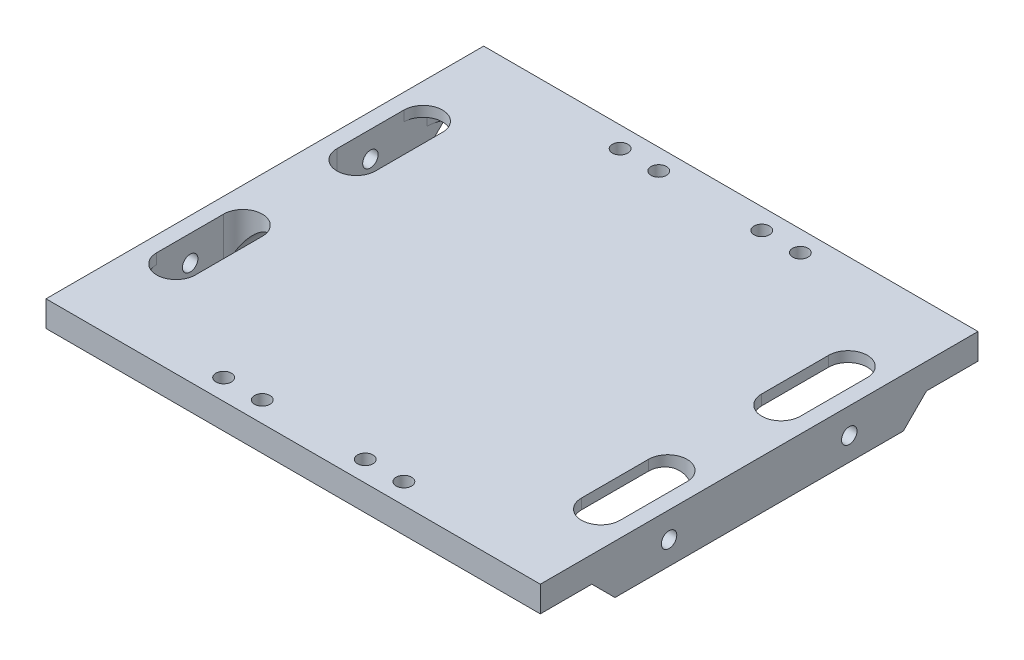
from build123d import *

# Parameters (mm, degrees)
BOSS_EXTRUDE1_DEPTH = 85
SKETCH3_R           = 1.5
CUT_EXTRUDE2_DEPTH  = 129.44162098
CUT_EXTRUDE3_DEPTH  = 99.07777526
SKETCH5_W           = 90
SKETCH5_H           = 8
BOSS_EXTRUDE2_DEPTH = 3
SKETCH6_R           = 1.5
CUT_EXTRUDE4_DEPTH  = 99.07777526
FILLET4_R           = 6
FILLET5_R           = 7.5
CUT_EXTRUDE5_DEPTH  = 129.44162098


with BuildPart() as part:
    # Sketch1 → Boss-Extrude1 (new body)
    with BuildSketch(Plane.XY):
        Polygon((-45, 0), (45, 0), (45, -7.5), (48, -7.5), (48, 2), (-48, 2), (-48, -7.5), (-45, -7.5), align=None)
    extrude(amount=BOSS_EXTRUDE1_DEPTH)

    # Sketch3 → Cut-Extrude2 (cut, through all)
    with BuildSketch(Plane.ZY.offset(48)):
        with Locations(Location((25, -3, 0), (0, 0, 270))):
            Circle(SKETCH3_R)
        with Locations(Location((60, -3, 0), (0, 0, 270))):
            Circle(SKETCH3_R)
    extrude(amount=-CUT_EXTRUDE2_DEPTH, mode=Mode.SUBTRACT)

    # Sketch4 → Cut-Extrude3 (cut, through all)
    with BuildSketch(Plane(origin=(0, 2, 0), x_dir=(1, 0, 0), z_dir=(0, 1, 0))):
        with BuildLine():
            Line((-37.5, -53.5), (-37.5, -66.5))
            ThreePointArc((-37.5, -66.5), (-41.25, -70.25), (-45, -66.5))
            Line((-45, -66.5), (-45, -53.5))
            ThreePointArc((-45, -53.5), (-41.25, -49.75), (-37.5, -53.5))
        make_face()
        with BuildLine():
            Line((-45, -18.5), (-45, -31.5))
            ThreePointArc((-45, -31.5), (-41.25, -35.25), (-37.5, -31.5))
            Line((-37.5, -31.5), (-37.5, -18.5))
            ThreePointArc((-37.5, -18.5), (-41.25, -14.75), (-45, -18.5))
        make_face()
        with BuildLine():
            Line((45, -31.5), (45, -18.5))
            ThreePointArc((45, -18.5), (41.25, -14.75), (37.5, -18.5))
            Line((37.5, -18.5), (37.5, -31.5))
            ThreePointArc((37.5, -31.5), (41.25, -35.25), (45, -31.5))
        make_face()
        with BuildLine():
            Line((45, -66.5), (45, -53.5))
            ThreePointArc((45, -53.5), (41.25, -49.75), (37.5, -53.5))
            Line((37.5, -53.5), (37.5, -66.5))
            ThreePointArc((37.5, -66.5), (41.25, -70.25), (45, -66.5))
        make_face()
    extrude(amount=-CUT_EXTRUDE3_DEPTH, mode=Mode.SUBTRACT)

    # Sketch5 → Boss-Extrude2 (add)
    with BuildSketch(Plane.XZ):
        with Locations((0, 81)):
            Rectangle(SKETCH5_W, SKETCH5_H)
        with Locations((0, 4)):
            Rectangle(SKETCH5_W, SKETCH5_H)
    extrude(amount=BOSS_EXTRUDE2_DEPTH)

    # Sketch6 → Cut-Extrude4 (cut, through all)
    with BuildSketch(Plane(origin=(0, 2, 0), x_dir=(1, 0, 0), z_dir=(0, 1, 0))):
        with Locations(Location((-17.5, -4, 0), (0, 0, 180))):
            Circle(SKETCH6_R)
        with Locations(Location((17.5, -4, 0), (0, 0, 180))):
            Circle(SKETCH6_R)
        with Locations(Location((-17.5, -81, 0), (0, 0, 180))):
            Circle(SKETCH6_R)
        with Locations(Location((17.5, -81, 0), (0, 0, 180))):
            Circle(SKETCH6_R)
        with Locations(Location((-10, -4, 0), (0, 0, 180))):
            Circle(SKETCH6_R)
        with Locations(Location((10, -4, 0), (0, 0, 180))):
            Circle(SKETCH6_R)
        with Locations(Location((-10, -81, 0), (0, 0, 180))):
            Circle(SKETCH6_R)
        with Locations(Location((10, -81, 0), (0, 0, 180))):
            Circle(SKETCH6_R)
    extrude(amount=-CUT_EXTRUDE4_DEPTH, mode=Mode.SUBTRACT)

    # Fillet4
    fillet4_edges = [part.edges().sort_by_distance(p)[0] for p in [
        (-45, -1.5, 77),
        (45, -1.5, 77),
        (-45, -1.5, 8),
        (45, -1.5, 8),
    ]]
    fillet(fillet4_edges, radius=FILLET4_R)

    # Fillet5
    fillet5_edges = [part.edges().sort_by_distance(p)[0] for p in [
        (45, 0, 42.5),
        (-45, 0, 42.5),
    ]]
    fillet(fillet5_edges, radius=FILLET5_R - 0.0001)  # a hair under: the kernel refuses the full size

    # Sketch7 → Cut-Extrude5 (cut, through all)
    with BuildSketch(Plane(origin=(48, 0, 0), x_dir=(0, 0, -1), z_dir=(1, 0, 0))):
        Polygon((-75, -3), (-85, -3), (-85, -7.5), (-70.5, -7.5), align=None)
        Polygon((-10, -3), (-14.5, -7.5), (0, -7.5), (0, -3), align=None)
    extrude(amount=-CUT_EXTRUDE5_DEPTH, mode=Mode.SUBTRACT)


solid = part.part
